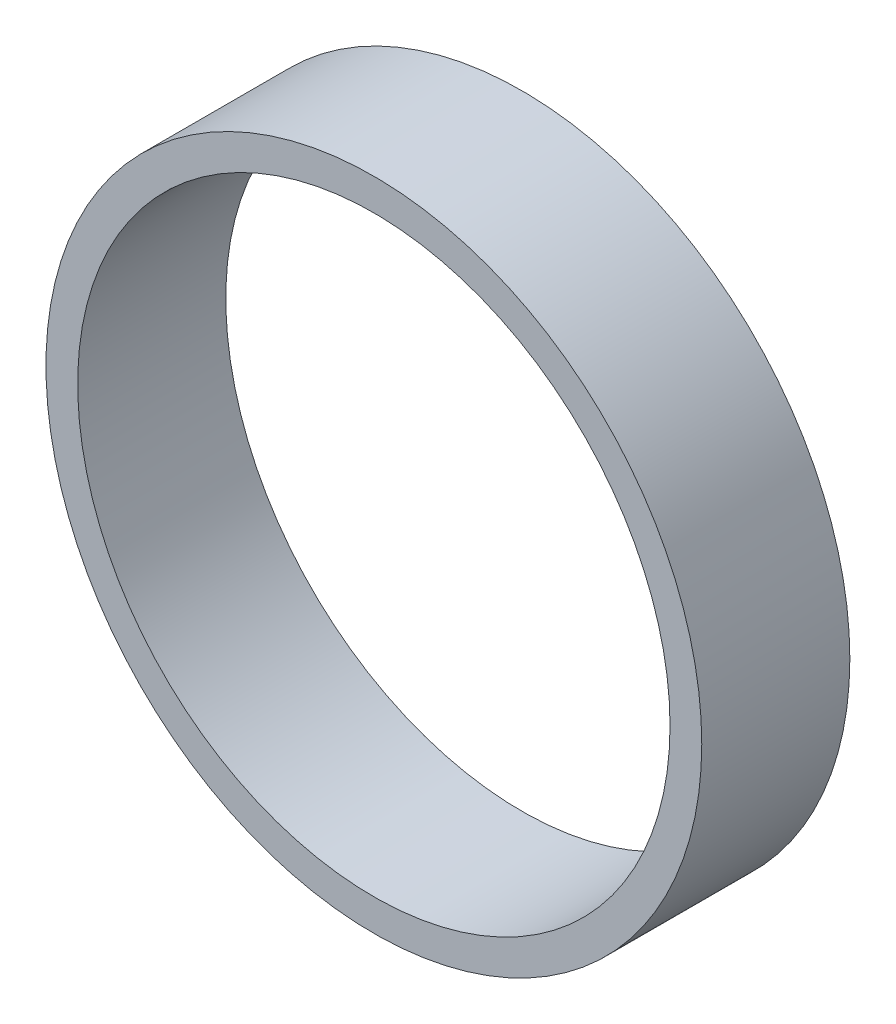
from build123d import *

# Parameters (mm, degrees)
SKETCH1_R           = 49.2125
SKETCH1_R_2         = 44.45
BOSS_EXTRUDE1_DEPTH = 11.1125


with BuildPart() as part:
    # Sketch1 → Boss-Extrude1 (new, symmetric)
    with BuildSketch(Plane.XY):
        Circle(SKETCH1_R)
        Circle(SKETCH1_R_2, mode=Mode.SUBTRACT)
    extrude(amount=BOSS_EXTRUDE1_DEPTH, both=True)


solid = part.part
